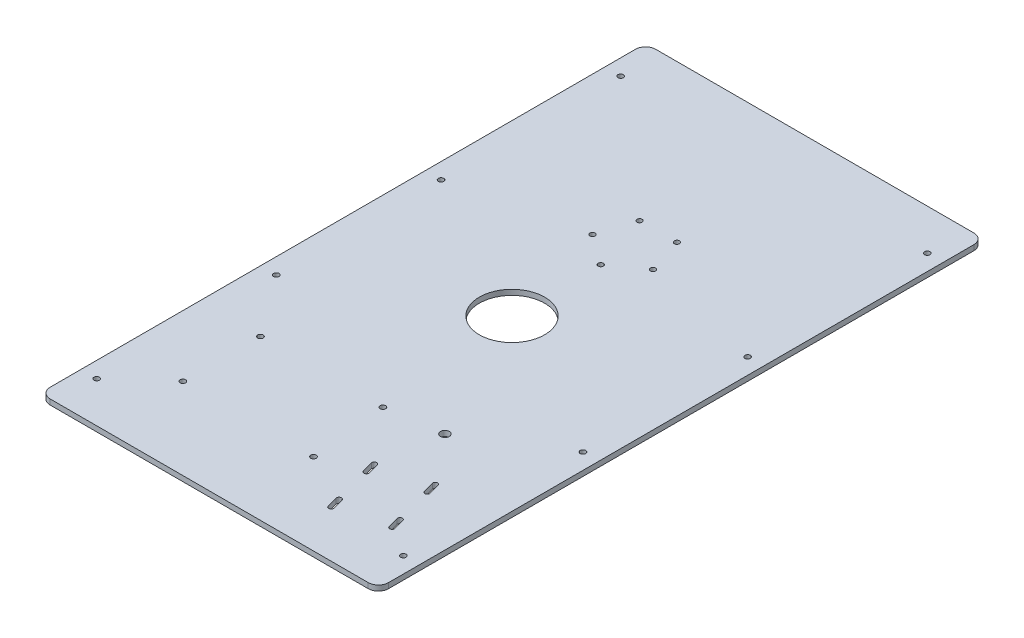
from build123d import *

# Parameters (mm, degrees)
BOSS_EXTRUDE1_DEPTH     = 3.302
M3_CLEARANCE_HOLE1_D    = 3.4
SKETCH6_W               = 210.566
SKETCH6_H               = 3.302
BOSS_EXTRUDE3_DEPTH     = 1.62
SKETCH7_W               = 210.566
SKETCH7_H               = 3.302
BOSS_EXTRUDE4_DEPTH     = 5.18
M3_CLEARANCE_HOLE2_D    = 3.4
SKETCH21_R              = 20.32
CUT_EXTRUDE1_DEPTH      = 336.371396057
ADVANCEDHOLE1_OUTLINE_R = 1.6
ADVANCEDHOLE1_DEPTH     = 3.302
CUT_EXTRUDE2_REACH      = 337.371
SKETCH33_W              = 167.386
SKETCH33_H              = 21.59
FILLET1_R               = 6.35
CUT_EXTRUDE3_DEPTH      = 315.946962825
M5_CLEARANCE_HOLE1_D    = 5.5
M3_CLEARANCE_HOLE3_D    = 3.4


# Read off the part's stored shape, not the designer's step: AdvancedHole1
with BuildPart() as part:
    # Sketch1 → Boss-Extrude1 (new body)
    with BuildSketch(Plane(origin=(0, 0, 0), x_dir=(1, 0, 0), z_dir=(0, 1, 0))):
        Polygon((105.283, -80.01), (105.283, 101.6), (-105.283, 101.6), (-105.283, -80.01), (-83.693, -80.01), (-83.693, -101.6), (83.693, -101.6), (83.693, -80.01), align=None)
    extrude(amount=BOSS_EXTRUDE1_DEPTH)

    # M3 Clearance Hole1 (through all)
    with Locations(Plane(origin=(0, 3.302, 0), x_dir=(1, 0, 0), z_dir=(0, 1, 0))):
        with Locations((-95.377, -54.61), (-95.377, 57.15), (95.377, 57.15), (95.377, -54.61)):
            Hole(M3_CLEARANCE_HOLE1_D / 2)

    # Sketch6 → Boss-Extrude3 (add)
    with BuildSketch(Plane(origin=(0, 0, -101.6), x_dir=(-1, 0, 0), z_dir=(0, 0, -1))):
        with Locations((0, 1.651)):
            Rectangle(SKETCH6_W, SKETCH6_H)
    extrude(amount=BOSS_EXTRUDE3_DEPTH)

    # Sketch7 → Boss-Extrude4 (add)
    with BuildSketch(Plane(origin=(0, 0, -103.22), x_dir=(-1, 0, 0), z_dir=(0, 0, -1))):
        with Locations((0, 1.651)):
            Rectangle(SKETCH7_W, SKETCH7_H)
    extrude(amount=BOSS_EXTRUDE4_DEPTH)


with BuildPart() as body_2:
    # Mirror2: mirrored copy
    add(part.part.mirror(Plane(origin=(0, 0, -108.4), x_dir=(1, 0, 0), z_dir=(0, 0, -1))))


with BuildPart() as part_1:
    add(part.part)

    # Combine1: union body 2
    add(body_2.part)

    # M3 Clearance Hole2 (through all)
    with Locations(Plane(origin=(0, 3.302, 0), x_dir=(1, 0, 0), z_dir=(0, 1, 0))):
        with Locations((-58.293, -91.6), (58.293, -91.6), (-58.293, 308.4), (58.293, 308.4)):
            Hole(M3_CLEARANCE_HOLE2_D / 2)

    # Sketch21 → Cut-Extrude1 (cut, through all)
    with BuildSketch(Plane(origin=(0, 3.302, 0), x_dir=(1, 0, 0), z_dir=(0, 1, 0))):
        with Locations(Location((0, 108.4, 0), (0, 0, 270))):
            Circle(SKETCH21_R)
    extrude(amount=-CUT_EXTRUDE1_DEPTH, mode=Mode.SUBTRACT)

    # AdvancedHole1 outline → AdvancedHole1 (cut)
    with BuildSketch(Plane(origin=(0, 0, 0), x_dir=(1, 0, 0), z_dir=(0, 1, 0))):
        with Locations((-11.624680448, 199.4)):
            Circle(ADVANCEDHOLE1_OUTLINE_R)
        with Locations((-18.809128073, 177.28854382)):
            Circle(ADVANCEDHOLE1_OUTLINE_R)
        with Locations((0, 163.62291236)):
            Circle(ADVANCEDHOLE1_OUTLINE_R)
        with Locations((18.809128073, 177.28854382)):
            Circle(ADVANCEDHOLE1_OUTLINE_R)
        with Locations((11.624680448, 199.4)):
            Circle(ADVANCEDHOLE1_OUTLINE_R)
    extrude(amount=ADVANCEDHOLE1_DEPTH, mode=Mode.SUBTRACT)

    # Sketch33 → Cut-Extrude2 (cut, up to next)
    with BuildSketch(Plane(origin=(0, 3.302, 0), x_dir=(1, 0, 0), z_dir=(0, 1, 0)), mode=Mode.PRIVATE) as cut_extrude2_sk1:
        with Locations((0, 307.605)):
            Rectangle(SKETCH33_W, SKETCH33_H)
    cut_extrude2_tool1 = extrude(cut_extrude2_sk1.sketch, amount=-CUT_EXTRUDE2_REACH, mode=Mode.PRIVATE) & part_1.part
    # Sketch33 → Cut-Extrude2 (cut, up to next)
    with BuildSketch(Plane(origin=(0, 3.302, 0), x_dir=(1, 0, 0), z_dir=(0, 1, 0)), mode=Mode.PRIVATE) as cut_extrude2_sk2:
        with Locations((0, -90.805)):
            Rectangle(SKETCH33_W, SKETCH33_H)
    cut_extrude2_tool2 = extrude(cut_extrude2_sk2.sketch, amount=-CUT_EXTRUDE2_REACH, mode=Mode.PRIVATE) & part_1.part
    add(cut_extrude2_tool1.solids().sort_by_distance((0, 3.302, -307.605))[0], mode=Mode.SUBTRACT)
    add(cut_extrude2_tool2.solids().sort_by_distance((0, 3.302, 90.805))[0], mode=Mode.SUBTRACT)

    # Fillet1
    fillet1_edges = [part_1.edges().sort_by_distance(p)[0] for p in [
        (-105.283, 1.651, 80.01),
        (105.283, 1.651, 80.01),
        (105.283, 1.651, -296.81),
        (-105.283, 1.651, -296.81),
    ]]
    fillet(fillet1_edges, radius=FILLET1_R)

    # Sketch24 → Cut-Extrude3 (cut, through all)
    with BuildSketch(Plane(origin=(0, 3.302, 0), x_dir=(1, 0, 0), z_dir=(0, 1, 0))):
        with BuildLine():
            Line((68.288075685, -5.771611822), (70.099809001, -12.533092606))
            ThreePointArc((70.099809001, -12.533092606), (69.039148829, -14.370209913), (67.202031522, -13.309549741))
            Line((67.202031522, -13.309549741), (65.390298207, -6.548068957))
            ThreePointArc((65.390298207, -6.548068957), (66.450958378, -4.71095165), (68.288075685, -5.771611822))
        make_face()
        with BuildLine():
            Line((76.311466084, -35.715312437), (78.123199399, -42.476793221))
            ThreePointArc((78.123199399, -42.476793221), (77.062539228, -44.313910528), (75.22542192, -43.253250356))
            Line((75.22542192, -43.253250356), (73.413688605, -36.491769572))
            ThreePointArc((73.413688605, -36.491769572), (74.474348777, -34.654652265), (76.311466084, -35.715312437))
        make_face()
        with BuildLine():
            Line((38.34437507, -13.79500222), (40.156108386, -20.556483004))
            ThreePointArc((40.156108386, -20.556483004), (39.095448214, -22.393600311), (37.258330907, -21.332940139))
            Line((37.258330907, -21.332940139), (35.446597592, -14.571459355))
            ThreePointArc((35.446597592, -14.571459355), (36.507257763, -12.734342048), (38.34437507, -13.79500222))
        make_face()
        with BuildLine():
            Line((46.367765469, -43.738702835), (48.179498784, -50.500183619))
            ThreePointArc((48.179498784, -50.500183619), (47.118838613, -52.337300926), (45.281721306, -51.276640754))
            Line((45.281721306, -51.276640754), (43.46998799, -44.51515997))
            ThreePointArc((43.46998799, -44.51515997), (44.530648162, -42.678042663), (46.367765469, -43.738702835))
        make_face()
    extrude(amount=-CUT_EXTRUDE3_DEPTH, mode=Mode.SUBTRACT)

    # M5 Clearance Hole1 (through all)
    with Locations(Plane(origin=(0, 3.302, 0), x_dir=(1, 0, 0), z_dir=(0, 1, 0))):
        with Locations((42.731024346, 23.92564608)):
            Hole(M5_CLEARANCE_HOLE1_D / 2)

    # M3 Clearance Hole3 (through all)
    with Locations(Plane(origin=(0, 3.302, 0), x_dir=(1, 0, 0), z_dir=(0, 1, 0))):
        with Locations((9.017, 19.05), (14.097, -29.21), (-67.183, 19.05), (-67.183, -29.21)):
            Hole(M3_CLEARANCE_HOLE3_D / 2)


solid = part_1.part
